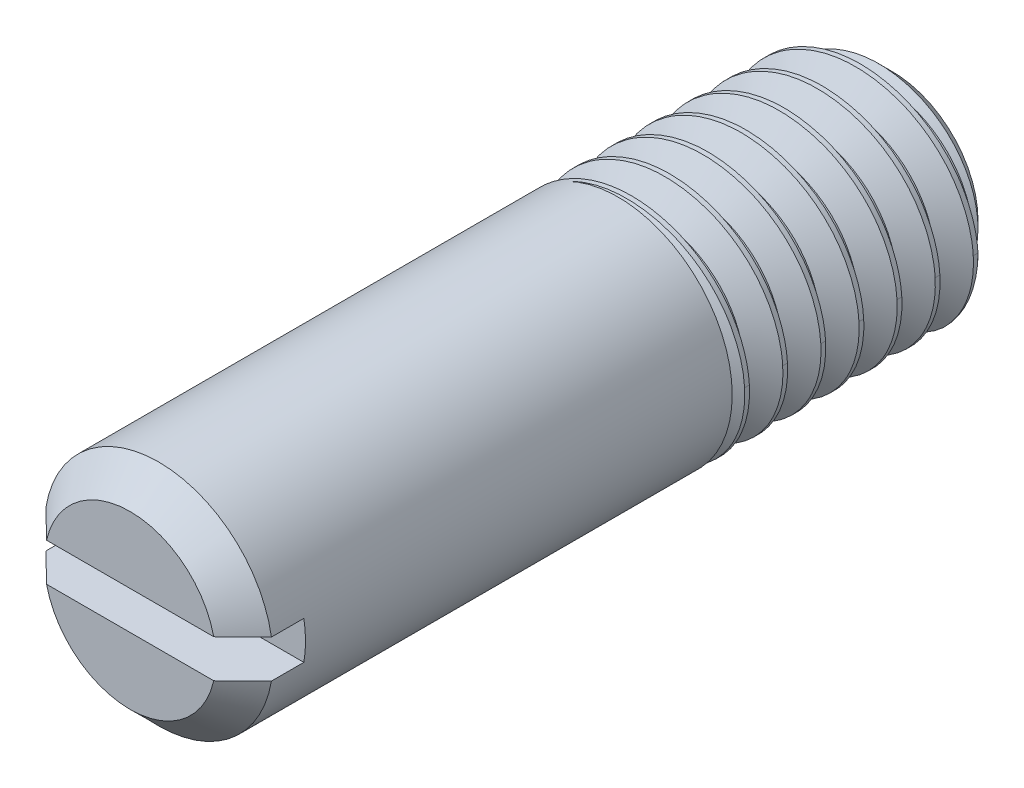
from build123d import *
from build123d.topology import SkipClean

# Parameters (mm, degrees)
SKETCH2_W               = 10
SKETCH2_H               = 1.5
CHAMFER2_SIZE           = 0.375
CUT_EXTRUDE1_DEPTH      = 7.742403132
CUT_EXTRUDE1_DEPTH_BACK = 7.742403132
SKETCH3_W               = 0.8
SKETCH3_H               = 0.5
CUT_SWEEP1_PITCH        = 0.5
BOSS_EXTRUDE2_START     = 0.5
SKETCH6_R               = 1.5
BOSS_EXTRUDE2_DEPTH     = 0.5


with BuildPart() as part:
    # Sketch2 → Revolve1 (revolve)
    with BuildSketch(Plane(origin=(0, 0, 0), x_dir=(0, 0, -1), z_dir=(1, 0, 0)), mode=Mode.PRIVATE) as revolve1_sk:
        with Locations((-1.4, 0.75)):
            Rectangle(SKETCH2_W, SKETCH2_H)
    revolve(revolve1_sk.sketch.rotate(Axis((0, 0, 6.4), (0, 0, -1)), 90), axis=Axis((0, 0, 6.4), (0, 0, -1)))

    # Chamfer2
    chamfer2_edges = [part.edges().sort_by_distance(p)[0] for p in [
        (-1.5, 0, 6.4),
        (-1.5, 0, -3.6),
    ]]
    chamfer(chamfer2_edges, length=CHAMFER2_SIZE)

    # Sketch3 → Cut-Extrude1 (cut, two sides: drawn at the far end of the back side and taken through both)
    with BuildSketch(Plane(origin=(0, 0, 0), x_dir=(0, 0, -1), z_dir=(1, 0, 0)).offset(-CUT_EXTRUDE1_DEPTH_BACK)):
        with Locations((-6, 0)):
            Rectangle(SKETCH3_W, SKETCH3_H)
    extrude(amount=CUT_EXTRUDE1_DEPTH + CUT_EXTRUDE1_DEPTH_BACK, mode=Mode.SUBTRACT)

    # Cut-Sweep1: the profile of Sketch5 profile screwed along a right-hand helix of 8.2 turns, 6 arcs to a turn; built about Z, then put on its axis
    cut_sweep1_z = Axis((0, 0, 0), (0, 0, 1))
    cut_sweep1_corners = [(1.5003, 0, 0.000173205), (1.5003, 0, -0.437673205), (1.175240474, 0, -0.25), (1.175240474, 0, -0.1875)]
    with BuildLine(mode=Mode.PRIVATE) as cut_sweep1_profile:
        Line(cut_sweep1_corners[0], cut_sweep1_corners[1])
        Line(cut_sweep1_corners[1], cut_sweep1_corners[2])
        Line(cut_sweep1_corners[2], cut_sweep1_corners[3])
        Line(cut_sweep1_corners[3], cut_sweep1_corners[0])
    cut_sweep1_cap = Face(cut_sweep1_profile.wire())
    cut_sweep1_turn_angles = [0, 30, 60, 90, 120, 150, 180, 210, 240, 270, 300, 330, 360]
    cut_sweep1_turn_weights = [1, 0.8660254037844387, 1, 0.8660254037844387, 1, 0.8660254037844387, 1, 0.8660254037844387, 1, 0.8660254037844387, 1, 0.8660254037844387, 1]
    cut_sweep1_turn_rails = [Edge.make_bspline([Vector(p[0], p[1], 0).rotate(cut_sweep1_z, cut_sweep1_turn_angles[k]) / cut_sweep1_turn_weights[k] + Vector(0, 0, p[2] + CUT_SWEEP1_PITCH * cut_sweep1_turn_angles[k] / 360) for k in range(13)], [0, 0, 0, 1, 1, 2, 2, 3, 3, 4, 4, 5, 5, 6, 6, 6], 2, cut_sweep1_turn_weights) for p in cut_sweep1_corners]
    cut_sweep1_turn_sides = [Face.make_surface_from_curves(cut_sweep1_turn_rails[p[0]], cut_sweep1_turn_rails[p[1]]) for p in [(0, 1), (1, 2), (2, 3), (3, 0)]]
    cut_sweep1_last_angles = [2880, 2910, 2940, 2946, 2952]
    cut_sweep1_last_weights = [1, 0.8660254037844387, 1, 0.9945218953682684, 1]
    cut_sweep1_last_rails = [Edge.make_bspline([Vector(p[0], p[1], 0).rotate(cut_sweep1_z, cut_sweep1_last_angles[k]) / cut_sweep1_last_weights[k] + Vector(0, 0, p[2] + CUT_SWEEP1_PITCH * cut_sweep1_last_angles[k] / 360) for k in range(5)], [0, 0, 0, 1, 1, 2, 2, 2], 2, cut_sweep1_last_weights) for p in cut_sweep1_corners]
    cut_sweep1_last_sides = [Face.make_surface_from_curves(cut_sweep1_last_rails[p[0]], cut_sweep1_last_rails[p[1]]) for p in [(0, 1), (1, 2), (2, 3), (3, 0)]]
    cut_sweep1 = Plane(origin=(0, 0, -3.6), x_dir=(0, 1, 0), z_dir=(0, 0, 1)) * Solid(Shell([*[p.moved(Location((0, 0, CUT_SWEEP1_PITCH * i))) for i in range(8) for p in cut_sweep1_turn_sides], *cut_sweep1_last_sides, cut_sweep1_cap, cut_sweep1_cap.rotate(cut_sweep1_z, 2952).moved(Location((0, 0, CUT_SWEEP1_PITCH * 2952 / 360)))]))
    add(cut_sweep1, mode=Mode.SUBTRACT)

    # Sketch6 → Boss-Extrude2 (add)
    with SkipClean():  # the faces are left unmerged after this step: merging them gives an invalid solid
        with BuildSketch(Plane.XY.offset(BOSS_EXTRUDE2_START)):
            Circle(SKETCH6_R)
        extrude(amount=-BOSS_EXTRUDE2_DEPTH)


solid = part.part
